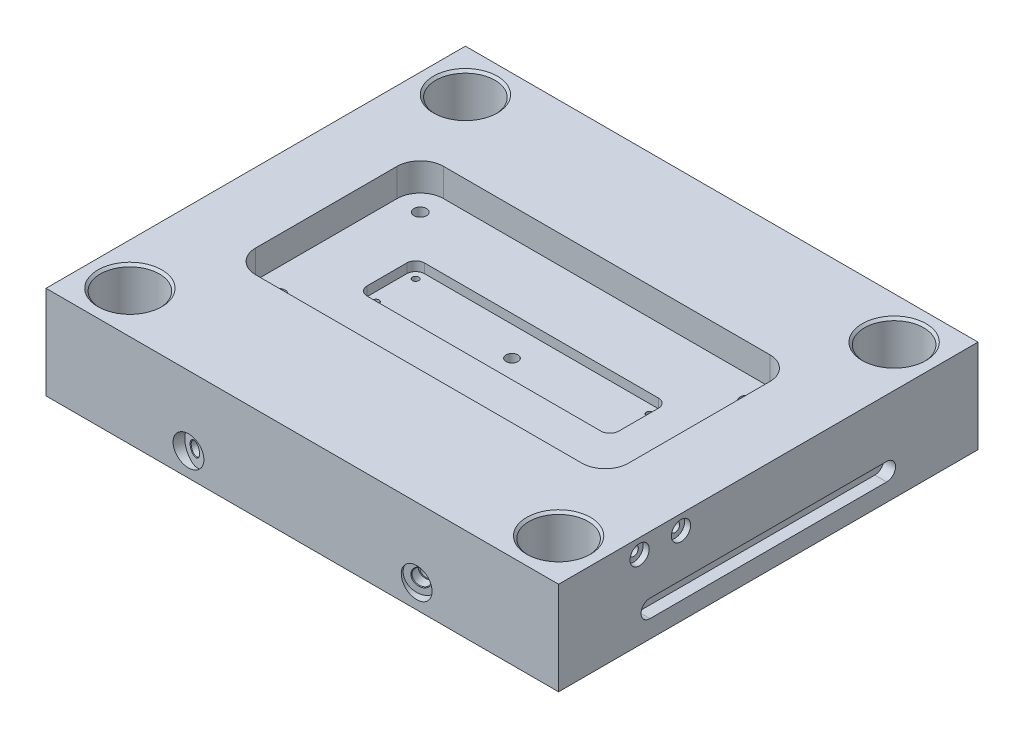
from build123d import *
from OCP.BRepAlgoAPI import BRepAlgoAPI_Cut
from OCP.TopTools import TopTools_ListOfShape

# Parameters (mm, degrees)
SKETCH1_W                                        = 550
SKETCH1_H                                        = 450
BOSS_EXTRUDE1_DEPTH                              = 100
CUT_EXTRUDE2_DEPTH                               = 30
F_1_2_THX_EJECTOR_PIN_CLEARANCE_HOLE1_D          = 12.7
SKETCH20_W                                       = 270
SKETCH20_H                                       = 61.6
CUT_EXTRUDE5_DEPTH                               = 10
FILLET4_R                                        = 9.525
CUT_EXTRUDE6_DEPTH                               = 12.7
CBORE_START                                      = -276
CBORE_FOR_3_8_BINDING_HEAD_MACHINE_S_2_R         = 5.0419
CBORE_FOR_3_8_BINDING_HEAD_MACHINE_SCREW_DEPTH   = 551
CBORE_START_2                                    = 182.943646178
CBORE_FOR_3_8_BINDING_HEAD_MACHINE_S_3_O_R       = 5.0419
CBORE_FOR_3_8_BINDING_HEAD_MACHINE_S_3_DEPTH     = 92.056353822
CBORE_START_3                                    = 268.5738
CBORE_FOR_3_8_BINDING_HEAD_MACHINE_S_4_O_R       = 10.31875
CBORE_FOR_3_8_BINDING_HEAD_MACHINE_S_4_O_R_2     = 5.0419
CBORE_FOR_3_8_BINDING_HEAD_MACHINE_S_4_DEPTH     = 6.4262
MIRROR2_START                                    = -275
MIRROR2_OUTLINE_R                                = 5.0419
MIRROR2_DEPTH                                    = 92.056359838
MIRROR2_2_OUTLINE_R                              = 10.31875
MIRROR2_2_OUTLINE_R_2                            = 5.0419
MIRROR2_2_DEPTH                                  = 6.4262
CBORE_FOR_1_4_SOCKET_HEAD_CAP_SCREW1_D           = 6.7564
CBORE_FOR_1_4_SOCKET_HEAD_CAP_SCREW1_CBORE_D     = 11.1125
CBORE_FOR_1_4_SOCKET_HEAD_CAP_SCREW1_CBORE_DEPTH = 6.35
F_3_8_NPT_TAPPED_HOLE1_AT_2_COUNT                = 2
F_3_8_NPT_TAPPED_HOLE1_AT_2_PITCH                = 127
CUT_EXTRUDE7_DEPTH                               = 606.173674917
CUT_EXTRUDE7_DEPTH_BACK                          = 7.62
SKETCH29_R                                       = 15.875
CUT_EXTRUDE8_DEPTH                               = 607.671638507
CUT_EXTRUDE8_DEPTH_BACK                          = 7.62
SKETCH33_R                                       = 15.875
CBORE_FOR_1_2_SOCKET_HEAD_CAP_SCREW1_D           = 13.49248
CBORE_FOR_1_2_SOCKET_HEAD_CAP_SCREW1_CBORE_D     = 20.6375
CBORE_FOR_1_2_SOCKET_HEAD_CAP_SCREW1_CBORE_DEPTH = 12.7
F_1_1_DIAMETER_HOLE1_D                           = 63.5
CHAMFER1_SIZE                                    = 2.54


with BuildPart() as part:
    # Sketch1 → Boss-Extrude1 (new body)
    with BuildSketch(Plane(origin=(0, 0, 0), x_dir=(1, 0, 0), z_dir=(0, 1, 0))):
        Rectangle(SKETCH1_W, SKETCH1_H)
    extrude(amount=BOSS_EXTRUDE1_DEPTH)

    # Sketch6 → Cut-Extrude2 (cut)
    with BuildSketch(Plane(origin=(0, 100, 0), x_dir=(1, 0, 0), z_dir=(0, 1, 0))):
        with BuildLine():
            Line((-175, 101.6), (175, 101.6))
            ThreePointArc((175, 101.6), (192.67766953, 94.27766953), (200, 76.6))
            Line((200, 76.6), (200, -75))
            ThreePointArc((200, -75), (192.67766953, -92.67766953), (175, -100))
            Line((175, -100), (-175, -100))
            ThreePointArc((-175, -100), (-192.67766953, -92.67766953), (-200, -75))
            Line((-200, -75), (-200, 76.6))
            ThreePointArc((-200, 76.6), (-192.67766953, 94.27766953), (-175, 101.6))
        make_face()
    extrude(amount=-CUT_EXTRUDE2_DEPTH, mode=Mode.SUBTRACT)

    # 1/2 THX Ejector Pin Clearance Hole1 (through all)
    with Locations(Plane(origin=(0, 70, 0), x_dir=(1, 0, 0), z_dir=(0, 1, 0))):
        with Locations((0, 0)):
            Hole(F_1_2_THX_EJECTOR_PIN_CLEARANCE_HOLE1_D / 2)

    # Sketch20 → Cut-Extrude5 (cut)
    with BuildSketch(Plane(origin=(0, 70, 0), x_dir=(1, 0, 0), z_dir=(0, 1, 0))):
        with Locations((0, 0.8)):
            Rectangle(SKETCH20_W, SKETCH20_H)
    extrude(amount=-CUT_EXTRUDE5_DEPTH, mode=Mode.SUBTRACT)

    # Fillet4
    fillet4_edges = [part.edges().sort_by_distance(p)[0] for p in [
        (-135, 65, 30),
        (-135, 65, -31.6),
        (135, 65, -31.6),
        (135, 65, 30),
    ]]
    fillet(fillet4_edges, radius=FILLET4_R)

    # Sketch21 → Cut-Extrude6 (cut)
    with BuildSketch(Plane(origin=(275, 0, 0), x_dir=(0, 0, -1), z_dir=(1, 0, 0))):
        with BuildLine():
            Line((-127, 38.1), (127, 38.1))
            ThreePointArc((127, 38.1), (136.525, 28.575), (127, 19.05))
            Line((127, 19.05), (-127, 19.05))
            ThreePointArc((-127, 19.05), (-136.525, 28.575), (-127, 38.1))
        make_face()
    cut_extrude6 = extrude(amount=-CUT_EXTRUDE6_DEPTH, mode=Mode.SUBTRACT)

    # Mirror1: Cut-Extrude6 across plane
    add(cut_extrude6.mirror(Plane(origin=(0, 0, 0), x_dir=(0, 0, 1), z_dir=(1, 0, 0))), mode=Mode.SUBTRACT)


with BuildPart() as cbore_for_3_8_binding_head_machine_screw_tool:
    # CBORE for 3/8 Binding Head Machine Screw1: read off the stored shape, not the designer's step
    # CBORE for 3_8 Binding Head Machine S 2 → CBORE for 3/8 Binding Head Machine Screw1 (new body)
    with BuildSketch(Plane.YZ.offset(CBORE_START)):
        with Locations((84.125, 138.1125)):
            Circle(CBORE_FOR_3_8_BINDING_HEAD_MACHINE_S_2_R)
    extrude(amount=CBORE_FOR_3_8_BINDING_HEAD_MACHINE_SCREW_DEPTH)


with BuildPart() as part_1:
    add(part.part)

    # CBORE for 3/8 Binding Head Machine Screw1: cut by cbore_for_3_8_binding_head_machine_screw_tool, with a tolerance
    cbore_for_3_8_binding_head_machine_screw_stock = TopTools_ListOfShape()
    cbore_for_3_8_binding_head_machine_screw_stock.Append(part_1.part.wrapped)
    cbore_for_3_8_binding_head_machine_screw_tools = TopTools_ListOfShape()
    cbore_for_3_8_binding_head_machine_screw_tools.Append(cbore_for_3_8_binding_head_machine_screw_tool.part.wrapped)
    cbore_for_3_8_binding_head_machine_screw_cut = BRepAlgoAPI_Cut()
    cbore_for_3_8_binding_head_machine_screw_cut.SetArguments(cbore_for_3_8_binding_head_machine_screw_stock)
    cbore_for_3_8_binding_head_machine_screw_cut.SetTools(cbore_for_3_8_binding_head_machine_screw_tools)
    cbore_for_3_8_binding_head_machine_screw_cut.SetFuzzyValue(0.00001)
    cbore_for_3_8_binding_head_machine_screw_cut.Build()
    add(Compound.cast(cbore_for_3_8_binding_head_machine_screw_cut.Shape()).solids(), mode=Mode.REPLACE)


with BuildPart() as cbore_for_3_8_binding_head_machine_s_3_tool:
    # CBORE for 3_8 Binding Head Machine S 3 o → CBORE for 3_8 Binding Head Machine S 3 (new body)
    with BuildSketch(Plane.YZ.offset(CBORE_START_2)):
        with Locations((84.125, 93.6625)):
            Circle(CBORE_FOR_3_8_BINDING_HEAD_MACHINE_S_3_O_R)
    extrude(amount=CBORE_FOR_3_8_BINDING_HEAD_MACHINE_S_3_DEPTH)


with BuildPart() as part_2:
    add(part_1.part)

    # CBORE for 3_8 Binding Head Machine S 3: cut by cbore_for_3_8_binding_head_machine_s_3_tool, with a tolerance
    cbore_for_3_8_binding_head_machine_s_3_stock = TopTools_ListOfShape()
    cbore_for_3_8_binding_head_machine_s_3_stock.Append(part_2.part.wrapped)
    cbore_for_3_8_binding_head_machine_s_3_tools = TopTools_ListOfShape()
    cbore_for_3_8_binding_head_machine_s_3_tools.Append(cbore_for_3_8_binding_head_machine_s_3_tool.part.wrapped)
    cbore_for_3_8_binding_head_machine_s_3_cut = BRepAlgoAPI_Cut()
    cbore_for_3_8_binding_head_machine_s_3_cut.SetArguments(cbore_for_3_8_binding_head_machine_s_3_stock)
    cbore_for_3_8_binding_head_machine_s_3_cut.SetTools(cbore_for_3_8_binding_head_machine_s_3_tools)
    cbore_for_3_8_binding_head_machine_s_3_cut.SetFuzzyValue(0.00001)
    cbore_for_3_8_binding_head_machine_s_3_cut.Build()
    add(Compound.cast(cbore_for_3_8_binding_head_machine_s_3_cut.Shape()).solids(), mode=Mode.REPLACE)


with BuildPart() as cbore_for_3_8_binding_head_machine_s_4_tool:
    # CBORE for 3_8 Binding Head Machine S 4 o → CBORE for 3_8 Binding Head Machine S 4 (new body)
    # profile 1 of 2: a face of its own
    with BuildSketch(Plane.YZ.offset(CBORE_START_3)):
        with Locations((84.125, 93.6625)):
            Circle(CBORE_FOR_3_8_BINDING_HEAD_MACHINE_S_4_O_R)
        with Locations((84.125, 93.6625)):
            Circle(CBORE_FOR_3_8_BINDING_HEAD_MACHINE_S_4_O_R_2, mode=Mode.SUBTRACT)
    # profile 2 of 2: a face of its own
    with BuildSketch(Plane.YZ.offset(CBORE_START_3)):
        with Locations((84.125, 138.1125)):
            Circle(CBORE_FOR_3_8_BINDING_HEAD_MACHINE_S_4_O_R)
        with Locations((84.125, 138.1125)):
            Circle(CBORE_FOR_3_8_BINDING_HEAD_MACHINE_S_4_O_R_2, mode=Mode.SUBTRACT)
    extrude(amount=CBORE_FOR_3_8_BINDING_HEAD_MACHINE_S_4_DEPTH)


with BuildPart() as part_3:
    add(part_2.part)

    # CBORE for 3_8 Binding Head Machine S 4: cut by cbore_for_3_8_binding_head_machine_s_4_tool, with a tolerance
    cbore_for_3_8_binding_head_machine_s_4_stock = TopTools_ListOfShape()
    cbore_for_3_8_binding_head_machine_s_4_stock.Append(part_3.part.wrapped)
    cbore_for_3_8_binding_head_machine_s_4_tools = TopTools_ListOfShape()
    cbore_for_3_8_binding_head_machine_s_4_tools.Append(cbore_for_3_8_binding_head_machine_s_4_tool.part.wrapped)
    cbore_for_3_8_binding_head_machine_s_4_cut = BRepAlgoAPI_Cut()
    cbore_for_3_8_binding_head_machine_s_4_cut.SetArguments(cbore_for_3_8_binding_head_machine_s_4_stock)
    cbore_for_3_8_binding_head_machine_s_4_cut.SetTools(cbore_for_3_8_binding_head_machine_s_4_tools)
    cbore_for_3_8_binding_head_machine_s_4_cut.SetFuzzyValue(0.00001)
    cbore_for_3_8_binding_head_machine_s_4_cut.Build()
    add(Compound.cast(cbore_for_3_8_binding_head_machine_s_4_cut.Shape()).solids(), mode=Mode.REPLACE)

    # Mirror2: read off the stored shape, not the designer's step
    # Mirror2 outline → Mirror2 (cut)
    with BuildSketch(Plane.YZ.offset(MIRROR2_START)):
        with Locations((84.125, 93.6625)):
            Circle(MIRROR2_OUTLINE_R)
    extrude(amount=MIRROR2_DEPTH, mode=Mode.SUBTRACT)

    # Mirror2 2 outline → Mirror2 2 (cut)
    # profile 1 of 2: a face of its own
    with BuildSketch(Plane.YZ.offset(MIRROR2_START)):
        with Locations((84.125, 93.6625)):
            Circle(MIRROR2_2_OUTLINE_R)
        with Locations((84.125, 93.6625)):
            Circle(MIRROR2_2_OUTLINE_R_2, mode=Mode.SUBTRACT)
    # profile 2 of 2: a face of its own
    with BuildSketch(Plane.YZ.offset(MIRROR2_START)):
        with Locations((84.125, 138.1125)):
            Circle(MIRROR2_2_OUTLINE_R)
    extrude(amount=MIRROR2_2_DEPTH, mode=Mode.SUBTRACT)

    # CBORE for 1/4 Socket Head Cap Screw1 (through all)
    with Locations(Plane(origin=(0, 0, 0), x_dir=(-1, 0, 0), z_dir=(0, -1, 0))):
        with Locations((125.475, -20.475), (-125.475, -20.475), (-125.475, 22.075), (125.475, 22.075)):
            CounterBoreHole(CBORE_FOR_1_4_SOCKET_HEAD_CAP_SCREW1_D / 2, CBORE_FOR_1_4_SOCKET_HEAD_CAP_SCREW1_CBORE_D / 2, CBORE_FOR_1_4_SOCKET_HEAD_CAP_SCREW1_CBORE_DEPTH)

    # Sketch26 → 3/8 NPT Tapped Hole1 (revolve, cut)
    with BuildSketch(Plane(origin=(63.5, 25.4, -225), x_dir=(0, 1, 0), z_dir=(1, 0, 0))):
        Polygon((0, 0), (0, 258.288582582), (7.1374, 254), (7.1374, 10.3378), (8.282213774, 10.3378), (8.5727286, 0.635), (9.2077286, 0), align=None)
    f_3_8_npt_tapped_hole1 = revolve(axis=Axis((63.5, 25.4, -231.35), (0, 0, 1)), mode=Mode.SUBTRACT)

    # 3/8 NPT Tapped Hole1 at 2: 3/8 NPT Tapped Hole1 ×2
    with Locations(*[(-i * F_3_8_NPT_TAPPED_HOLE1_AT_2_PITCH, 0, 0) for i in range(1, F_3_8_NPT_TAPPED_HOLE1_AT_2_COUNT)]):
        add(f_3_8_npt_tapped_hole1, mode=Mode.SUBTRACT)

    # Sketch29 → Cut-Extrude7 (cut, two sides: drawn at the far end of the back side and taken through both)
    with BuildSketch(Plane(origin=(122.705942623, 25.4, 225), x_dir=(0.9597609922417035, 0, -0.2808181578374536), z_dir=(0.2808181578374536, 0, 0.9597609922417035)).offset(-CUT_EXTRUDE7_DEPTH_BACK)):
        with Locations(Location((0, 0, 0), (0, 0, 180))):
            Circle(SKETCH29_R)
    extrude(amount=CUT_EXTRUDE7_DEPTH + CUT_EXTRUDE7_DEPTH_BACK, mode=Mode.SUBTRACT)

    # 3/8 NPT Tapped Hole2: read off the stored shape, not the designer's step
    # 3/8 NPT Tapped Hole2 outline → 3/8 NPT Tapped Hole2 (revolve, cut)
    with BuildSketch(Plane(origin=(52.387873994, 25.4, -15.328260251), x_dir=(0.9597609922417033, 0, -0.2808181578374542), z_dir=(0, -1, 0))):
        Polygon((0, 242.784280017), (0, 43.659469699), (7.1374, 43.659469699), (7.1374, 232.446480017), (8.282213774, 232.446480017), (8.5727286, 242.149280017), (9.2077286, 242.784280017), align=None)
    revolve(axis=Axis((52.387873994, 25.4, -15.328260251), (0.28081815783745423, 0, 0.9597609922417035)), mode=Mode.SUBTRACT)

    # Sketch33 → Cut-Extrude8 (cut, two sides: drawn at the far end of the back side and taken through both)
    with BuildSketch(Plane(origin=(-122.705942623, 25.4, 227.0125), x_dir=(0.9605035123652085, 0, 0.27826786148259725), z_dir=(-0.27826786148259725, 0, 0.9605035123652085)).offset(-CUT_EXTRUDE8_DEPTH_BACK)):
        Circle(SKETCH33_R)
    extrude(amount=CUT_EXTRUDE8_DEPTH + CUT_EXTRUDE8_DEPTH_BACK, mode=Mode.SUBTRACT)

    # 1/4 NPT Tapped Hole3: read off the stored shape, not the designer's step
    # 1/4 NPT Tapped Hole3 outline → 1/4 NPT Tapped Hole3 (revolve, cut)
    with BuildSketch(Plane(origin=(-52.529174425, 25.4, -15.218248392), x_dir=(0.9605035123652085, 0, 0.2782678614825972), z_dir=(0, 1, 0))):
        Polygon((5.5626, -234.538423846), (5.5626, -45.874246896), (0, -45.874246896), (0, -244.571423846), (7.4676, -244.571423846), (6.858381, -243.962204846), (6.576220377, -234.538423846), align=None)
    revolve(axis=Axis((-52.529174425, 25.4, -15.218248392), (0.2782678614825972, 0, -0.9605035123652085)), mode=Mode.SUBTRACT)

    # CBORE for 1/2 Socket Head Cap Screw1 (through all)
    with Locations(Plane(origin=(0, 0, 0), x_dir=(-1, 0, 0), z_dir=(0, -1, 0))):
        with Locations((175, -75), (175, 76.6), (-175, 76.6), (-175, -75)):
            CounterBoreHole(CBORE_FOR_1_2_SOCKET_HEAD_CAP_SCREW1_D / 2, CBORE_FOR_1_2_SOCKET_HEAD_CAP_SCREW1_CBORE_D / 2, CBORE_FOR_1_2_SOCKET_HEAD_CAP_SCREW1_CBORE_DEPTH)

    # 1 (1) Diameter Hole1 (through all)
    with Locations(Plane(origin=(0, 100, 0), x_dir=(1, 0, 0), z_dir=(0, 1, 0))):
        with Locations((230, 180), (-230, 180), (-230, -180), (230, -180)):
            Hole(F_1_1_DIAMETER_HOLE1_D / 2)

    # Chamfer1
    chamfer1_edges = [part_3.edges().sort_by_distance(p)[0] for p in [
        (261.75, 100, 180),
        (-198.25, 100, 180),
        (-198.25, 100, -180),
        (261.75, 100, -180),
    ]]
    chamfer(chamfer1_edges, length=CHAMFER1_SIZE)


solid = part_3.part
